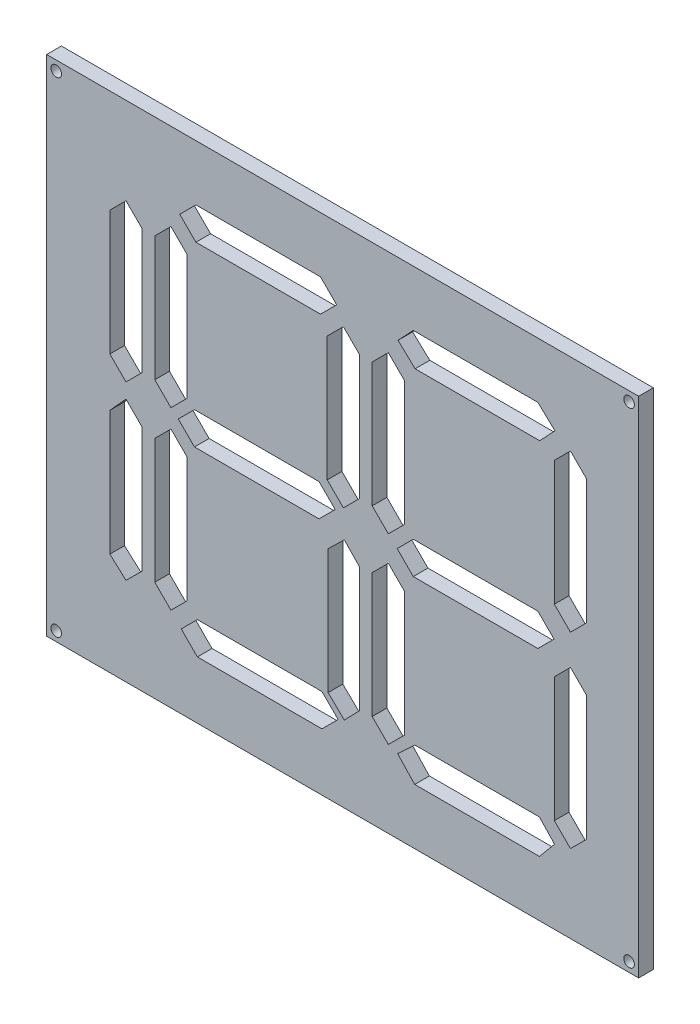
from build123d import *

# Parameters (mm, degrees)
SKETCH1_W          = 201.5
SKETCH1_H          = 171.5
MAIN_BODY_DEPTH    = 5
CUT_START          = -5
CUT_AREA_OUTLINE_R = 1.8
CUT_AREA_DEPTH     = 5


# Read off the part's stored shape, not the designer's step: Cut Area
with BuildPart() as part:
    # Sketch1 → Main Body (new body)
    with BuildSketch(Plane.XY):
        Rectangle(SKETCH1_W, SKETCH1_H)
    extrude(amount=MAIN_BODY_DEPTH)

    # Cut Area outline → Cut Area (cut)
    with BuildSketch(Plane.XY.offset(5).offset(CUT_START)):
        Polygon((-68.25, 50.627106781), (-73.75, 56.127106781), (-79.25, 50.627106781), (-79.25, 8.212893219), (-73.75, 2.712893219), (-68.25, 8.212893219), align=None)
        Polygon((-73.731881274, -55.768988055), (-68.25, -50.287106781), (-68.25, -7.872893219), (-73.767236503, -2.355656716), (-79.25, -8.386696563), (-79.25, -50.802681202), align=None)
        with Locations((97.5, 82.5)):
            Circle(CUT_AREA_OUTLINE_R)
        with Locations((-97.5, -82.5)):
            Circle(CUT_AREA_OUTLINE_R)
        with Locations((97.5, -82.5)):
            Circle(CUT_AREA_OUTLINE_R)
        Polygon((-8.042893219, 6.2), (-50.457106781, 6.2), (-55.957106781, 0.7), (-50.457106781, -4.8), (-8.042893219, -4.8), (-2.542893219, 0.7), align=None)
        Polygon((-49.457106781, -55.2), (-54.957106781, -60.7), (-49.457106781, -66.2), (-7.042893219, -66.2), (-1.542893219, -60.7), (-7.042893219, -55.2), align=None)
        Polygon((5.75, 50.507106781), (0.25, 56.007106781), (-5.25, 50.507106781), (-5.25, 8.092893219), (0.25, 2.592893219), (5.75, 8.092893219), align=None)
        Polygon((0.560856139, -59.803608472), (5.75, -54.452624011), (5.75, -12.047441696), (0.561015758, -6.694204099), (-4.95, -12.036125396), (-4.95, -54.459428254), align=None)
        Polygon((66.448293895, 66.8), (24.033969108, 66.8), (18.837162213, 61.278595298), (24.657956105, 55.8), (67.072280892, 55.8), (72.269087787, 61.321404702), align=None)
        Polygon((-2.042893219, 61.3), (-7.542893219, 66.8), (-49.957106781, 66.8), (-55.457106781, 61.3), (-49.957106781, 55.8), (-7.542893219, 55.8), align=None)
        Polygon((-52.95, 8.272893219), (-52.95, 50.687106781), (-58.45, 56.187106781), (-63.95, 50.687106781), (-63.95, 8.272893219), (-58.45, 2.772893219), align=None)
        Polygon((-58.45, -56.927106781), (-52.95, -51.427106781), (-52.95, -9.012893219), (-58.45, -3.512893219), (-63.95, -9.012893219), (-63.95, -51.427106781), align=None)
        Polygon((24.042893219, 5.24), (18.542893219, -0.26), (24.042893219, -5.76), (66.457106781, -5.76), (71.957106781, -0.26), (66.457106781, 5.24), align=None)
        Polygon((83.05, 52.507106781), (77.55, 58.007106781), (72.05, 52.507106781), (72.05, 10.092893219), (77.55, 4.592893219), (83.05, 10.092893219), align=None)
        Polygon((77.55, -59.207106781), (83.05, -53.707106781), (83.05, -11.292893219), (77.55, -5.792893219), (72.05, -11.292893219), (72.05, -53.707106781), align=None)
        with Locations((-97.5, 82.5)):
            Circle(CUT_AREA_OUTLINE_R)
        Polygon((21.05, 50.507106781), (15.55, 56.007106781), (10.05, 50.507106781), (10.05, 8.092893219), (15.55, 2.592893219), (21.05, 8.092893219), align=None)
        Polygon((15.55, -59.507106781), (21.05, -54.007106781), (21.05, -11.592893219), (15.55, -6.092893219), (10.05, -11.592893219), (10.05, -54.007106781), align=None)
        Polygon((24.551704565, -55.16), (18.730025795, -60.638537988), (24.528319558, -66.8), (66.978214993, -66.8), (72.123248282, -60.640233696), (66.966029948, -55.16), align=None)
    extrude(amount=CUT_AREA_DEPTH, mode=Mode.SUBTRACT)


solid = part.part
